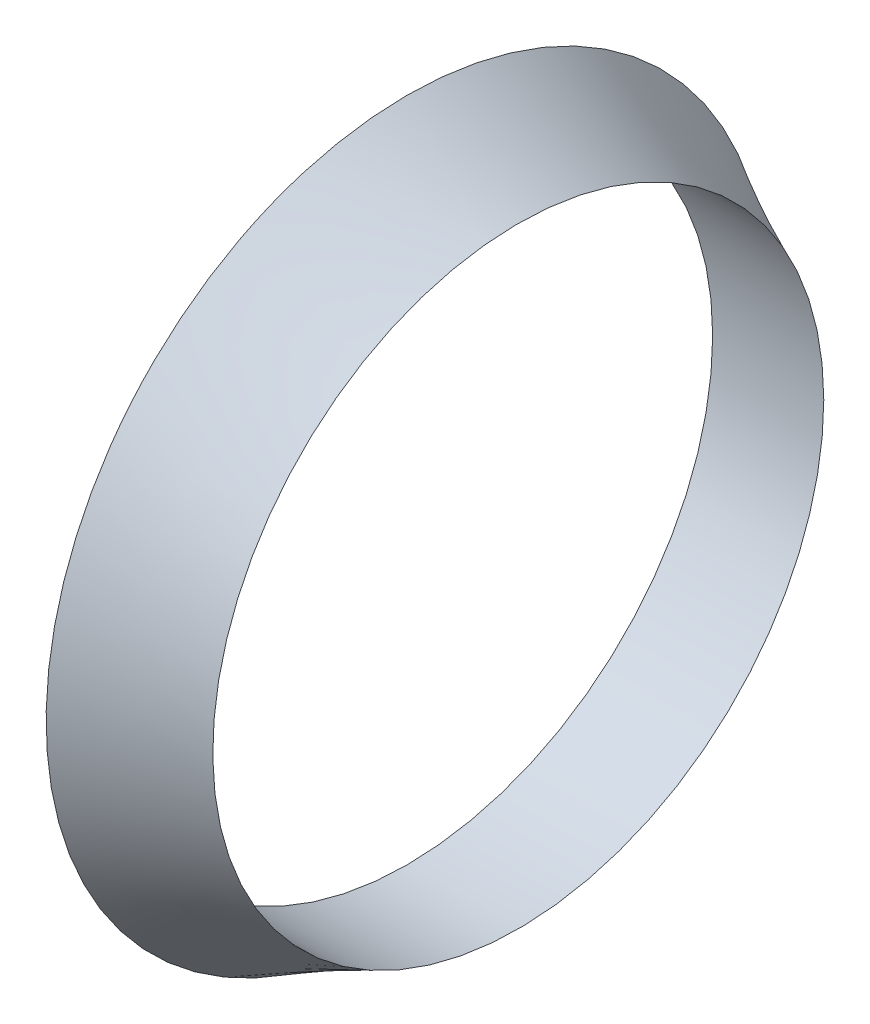
from build123d import *

# Parameters (mm, degrees)
SKETCH3_R          = 55
CUT_EXTRUDE1_DEPTH = 30


with BuildPart() as part:
    # Loft1: read off the stored shape, not the designer's step
    # Loft1: loft between two sections, ruled curve by curve
    loft1_from = [
        Edge.make_bspline([(20, -35.798412386, -41.754923909), (20, -119.308260204, 29.841900862), (20, -47.711435433, 113.351748681), (20, 35.798412386, 41.754923909), (20, 119.308260204, -29.841900862), (20, 47.711435433, -113.351748681), (20, -35.798412386, -41.754923909)], [0, 0, 0, 0, 0.5, 0.5, 0.5, 1, 1, 1, 1], 3, [1, 0.333333333, 0.333333333, 1, 0.333333333, 0.333333333, 1]),
    ]
    loft1_to = [
        Edge.make_bspline([(0, -52.562088692, -38.239074679), (0, -129.040238051, 66.885102705), (0, -23.916060666, 143.363252063), (0, 52.562088692, 38.239074679), (0, 129.040238051, -66.885102705), (0, 23.916060666, -143.363252063), (0, -52.562088692, -38.239074679)], [0, 0, 0, 0, 0.5, 0.5, 0.5, 1, 1, 1, 1], 3, [1, 0.333333333, 0.333333333, 1, 0.333333333, 0.333333333, 1]),
    ]
    loft1 = Solid(Shell([*[Face.make_surface_from_curves(loft1_from[k], loft1_to[k]) for k in range(1)], Face(Wire(loft1_from)), Face(Wire(loft1_to))]))
    add(loft1)

    # Sketch3 → Cut-Extrude1 (cut)
    with BuildSketch(Plane(origin=(20, 0, 0), x_dir=(0, 0, -1), z_dir=(1, 0, 0))):
        Circle(SKETCH3_R)
    extrude(amount=-CUT_EXTRUDE1_DEPTH, mode=Mode.SUBTRACT)


solid = part.part
